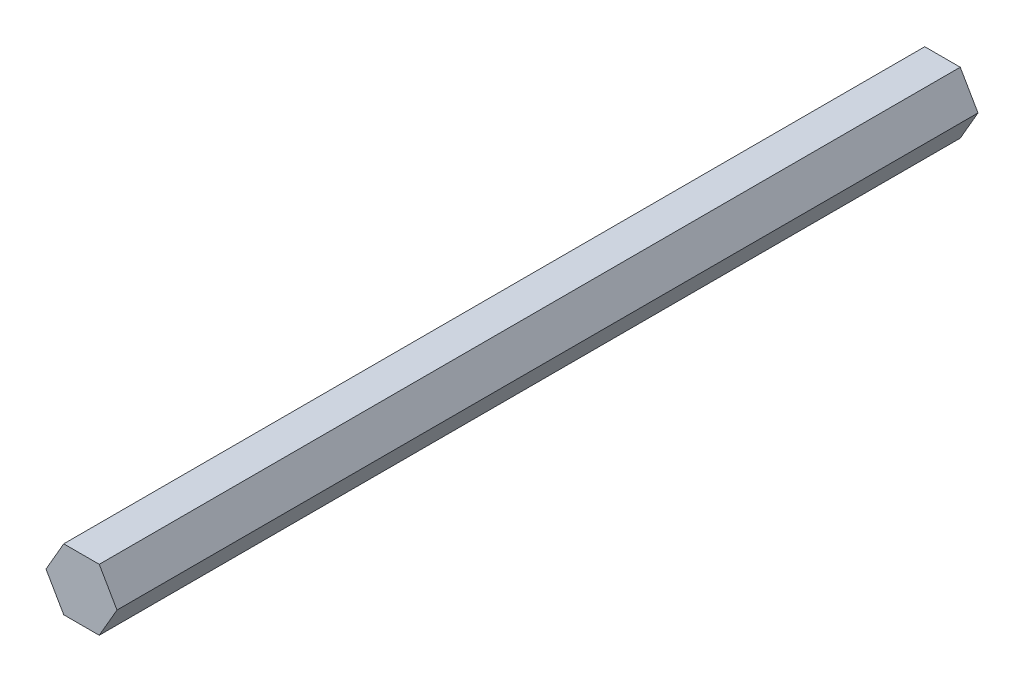
from build123d import *

# Parameters (mm, degrees)
BOSS_EXTRUDE1_DEPTH = 88.93175


with BuildPart() as part:
    # Sketch1 → Boss-Extrude1 (new, symmetric)
    with BuildSketch(Plane.XY):
        Polygon((3.666174209, 6.35), (-3.666174209, 6.35), (-7.332348419, 0), (-3.666174209, -6.35), (3.666174209, -6.35), (7.332348419, 0), align=None)
    extrude(amount=BOSS_EXTRUDE1_DEPTH, both=True)


solid = part.part
